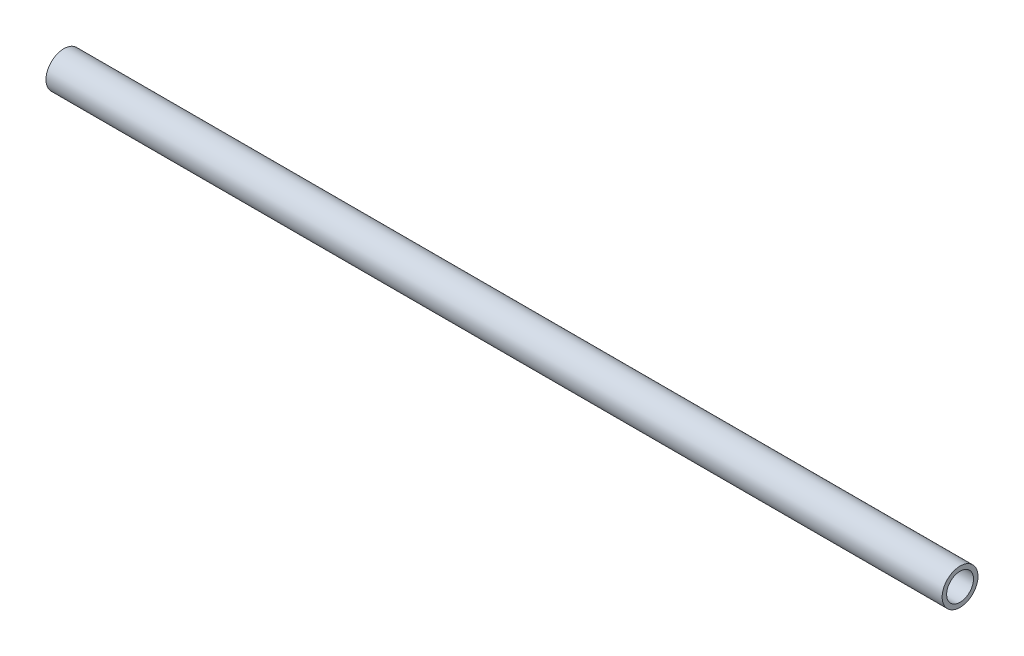
from build123d import *

# Parameters (mm, degrees)
SKETCH1_R           = 4
SKETCH1_R_2         = 3
BOSS_EXTRUDE1_DEPTH = 100


with BuildPart() as part:
    # Sketch1 → Boss-Extrude1 (new, symmetric)
    with BuildSketch(Plane(origin=(0, 0, 0), x_dir=(0, 0, -1), z_dir=(1, 0, 0))):
        Circle(SKETCH1_R)
        Circle(SKETCH1_R_2, mode=Mode.SUBTRACT)
    extrude(amount=BOSS_EXTRUDE1_DEPTH, both=True)


solid = part.part
